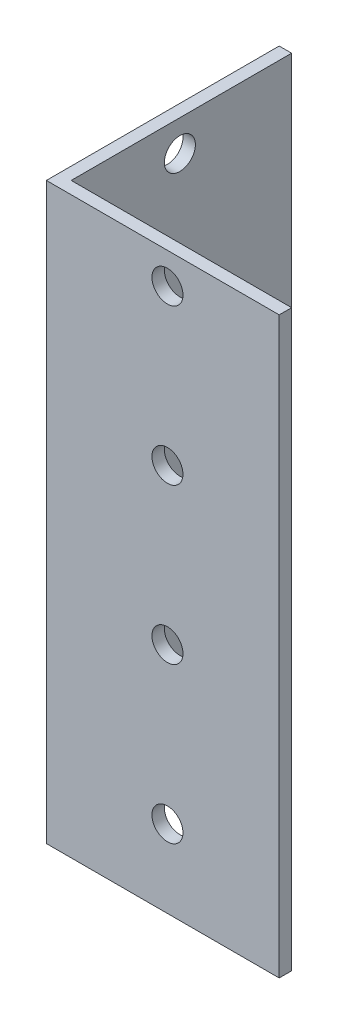
from build123d import *

# Parameters (mm, degrees)
EXTRUDE_1_DEPTH     = 185
SKETCH_2_R          = 5
CUT_EXTRUDE_1_DEPTH = 10
SKETCH_3_R          = 5
CUT_EXTRUDE_2_DEPTH = 10


with BuildPart() as part:
    # Эскиз1 → Вытянуть-Тонкостенный1 (new body)
    with BuildSketch(Plane(origin=(0, 0, 0), x_dir=(1, 0, 0), z_dir=(0, 1, 0))):
        Polygon((0, 75), (0, 0), (75, 0), (75, 4), (4, 4), (4, 75), align=None)
    extrude(amount=EXTRUDE_1_DEPTH)

    # Эскиз2 → Вырез-Вытянуть1 (cut)
    with BuildSketch(Plane.XY):
        with Locations((39, 175)):
            Circle(SKETCH_2_R)
        with Locations((39, 125)):
            Circle(SKETCH_2_R)
        with Locations((39, 75)):
            Circle(SKETCH_2_R)
        with Locations((39, 25)):
            Circle(SKETCH_2_R)
    extrude(amount=-CUT_EXTRUDE_1_DEPTH, mode=Mode.SUBTRACT)

    # Эскиз3 → Вырез-Вытянуть2 (cut)
    with BuildSketch(Plane.ZY):
        with Locations((-39, 175)):
            Circle(SKETCH_3_R)
        with Locations((-39, 125)):
            Circle(SKETCH_3_R)
        with Locations((-39, 75)):
            Circle(SKETCH_3_R)
        with Locations((-39, 25)):
            Circle(SKETCH_3_R)
    extrude(amount=-CUT_EXTRUDE_2_DEPTH, mode=Mode.SUBTRACT)


solid = part.part
